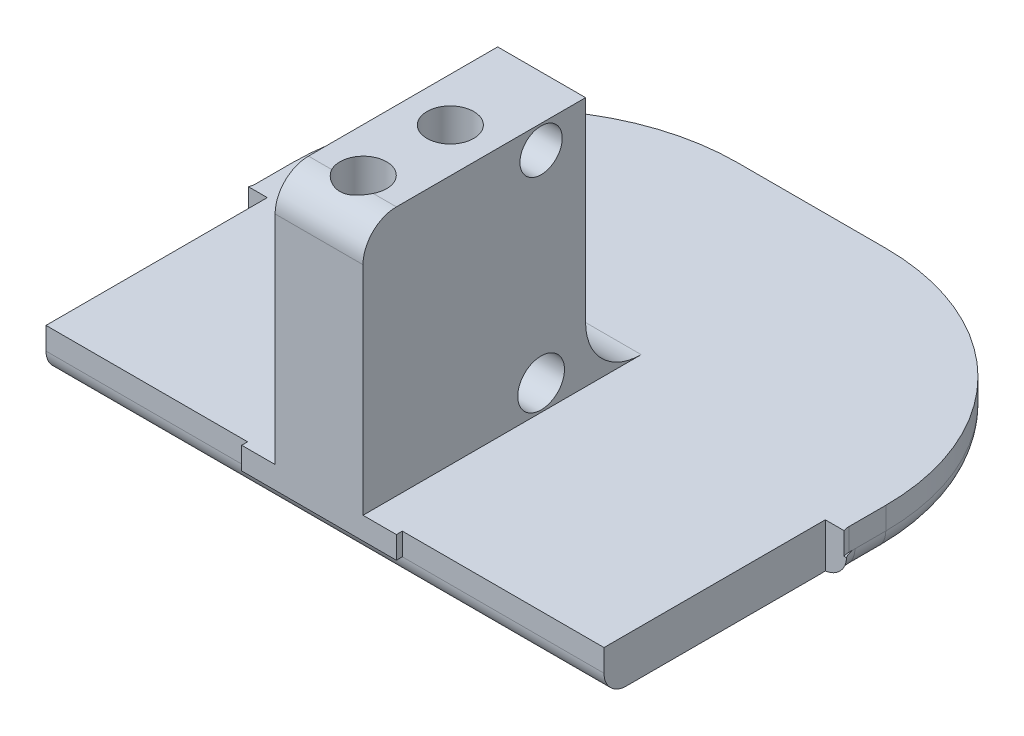
from build123d import *

# Parameters (mm, degrees)
SALIENTE_EXTRUIR1_DEPTH     = 2
CROQUIS2_W                  = 13.9
CROQUIS2_H                  = 20
SALIENTE_EXTRUIR2_DEPTH     = 24.5
SALIENTE_EXTRUIR3_DEPTH     = 22.5
CROQUIS5_R                  = 2.1
CORTAR_EXTRUIR2_DEPTH       = 20.5
CROQUIS16_W                 = 3
CROQUIS16_H                 = 33.930468167
CORTAR_EXTRUIR8_DEPTH       = 22.5
CORTAR_EXTRUIR1_DEPTH       = 27
CORTAR_EXTRUIR1_DEPTH_BACK  = 65.5
CROQUIS4_R                  = 1.599999999
REDONDEO1_R                 = 3
REDONDEO2_R                 = 5
SALIENTE_EXTRUIR5_START     = 2
SALIENTE_EXTRUIR5_DEPTH     = 2
REDONDEO6_R                 = 2
REDONDEO7_R                 = 2
CROQUIS17_R                 = 2.1
CORTAR_EXTRUIR9_DEPTH       = 10
CORTAR_EXTRUIR14_DEPTH      = 11
CORTAR_EXTRUIR14_DEPTH_BACK = 10
CROQUIS18_R                 = 1.9
CROQUIS19_R                 = 18.5
CORTAR_EXTRUIR15_DEPTH      = 3.5
CORTAR_EXTRUIR16_START      = -56
CROQUIS20_R                 = 18.5
CORTAR_EXTRUIR16_DEPTH      = 3.5
CORTAR_EXTRUIR17_DEPTH      = 47
CORTAR_EXTRUIR17_DEPTH_BACK = 86
CROQUIS21_W                 = 7.397871061
CROQUIS21_H                 = 19.885366365


# Some blends are built 0.0001 mm under size
with BuildPart() as part:
    # Croquis1 → Saliente-Extruir1 (new body)
    with BuildSketch(Plane(origin=(0, 0, 0), x_dir=(1, 0, 0), z_dir=(0, 1, 0))):
        with BuildLine():
            Line((-31.5, -9.464532567), (31.5, -9.464532567))
            Line((31.5, -9.464532567), (31.5, 7.964532567))
            ThreePointArc((31.5, 7.964532567), (31.060660172, 9.025192739), (30, 9.464532567))
            Line((30, 9.464532567), (28.160101256, 9.464532567))
            ThreePointArc((28.160101256, 9.464532567), (27.099441084, 9.903872396), (26.660101256, 10.964532567))
            Line((26.660101256, 10.964532567), (26.660101256, 14.266885585))
            ThreePointArc((26.660101256, 14.266885585), (20.802236879, 28.409021208), (6.660101256, 34.266885585))
            Line((6.660101256, 34.266885585), (-6.660101256, 34.266885585))
            ThreePointArc((-6.660101256, 34.266885585), (-20.802236879, 28.409021208), (-26.660101256, 14.266885585))
            Line((-26.660101256, 14.266885585), (-26.660101256, 10.964532567))
            ThreePointArc((-26.660101256, 10.964532567), (-27.099441084, 9.903872396), (-28.160101256, 9.464532567))
            Line((-28.160101256, 9.464532567), (-30, 9.464532567))
            ThreePointArc((-30, 9.464532567), (-31.060660172, 9.025192739), (-31.5, 7.964532567))
            Line((-31.5, 7.964532567), (-31.5, -9.464532567))
        make_face()
    extrude(amount=SALIENTE_EXTRUIR1_DEPTH)

    # Croquis2 → Saliente-Extruir2 (add)
    with BuildSketch(Plane(origin=(0, 0, 0), x_dir=(1, 0, 0), z_dir=(0, 1, 0))):
        Rectangle(CROQUIS2_W, CROQUIS2_H)
    extrude(amount=SALIENTE_EXTRUIR2_DEPTH)

    # Croquis3 → Saliente-Extruir3 (add)
    with BuildSketch(Plane(origin=(0, 2, 0), x_dir=(1, 0, 0), z_dir=(0, 1, 0))):
        with BuildLine():
            ThreePointArc((28.160101256, 9.464532567), (27.375457574, 9.686121721), (26.822638598, 10.285420177))
            Line((26.822638598, 10.285420177), (25.6, 10.285420177))
            Line((25.6, 10.285420177), (25.6, -2.749999823))
            Line((25.6, -2.749999823), (31.5, -2.749999823))
            Line((31.5, -2.749999823), (31.5, 7.964532567))
            ThreePointArc((31.5, 7.964532567), (31.060660172, 9.025192739), (30, 9.464532567))
            Line((30, 9.464532567), (28.160101256, 9.464532567))
        make_face()
        with BuildLine():
            Line((-25.6, 10.285420177), (-26.822638598, 10.285420177))
            ThreePointArc((-26.822638598, 10.285420177), (-27.375457574, 9.686121721), (-28.160101256, 9.464532567))
            Line((-28.160101256, 9.464532567), (-30, 9.464532567))
            ThreePointArc((-30, 9.464532567), (-31.060660172, 9.025192739), (-31.5, 7.964532567))
            Line((-31.5, 7.964532567), (-31.5, -2.749999823))
            Line((-31.5, -2.749999823), (-25.6, -2.749999823))
            Line((-25.6, -2.749999823), (-25.6, 10.285420177))
        make_face()
    extrude(amount=SALIENTE_EXTRUIR3_DEPTH)

    # Croquis5 → Cortar-Extruir2 (cut)
    with BuildSketch(Plane(origin=(0, 24.5, 0), x_dir=(1, 0, 0), z_dir=(0, 1, 0))):
        with Locations(Location((0, 1.798301608, 0), (0, 0, 270))):
            Circle(CROQUIS5_R)
        with Locations(Location((0, -6.026932469, 0), (0, 0, 270))):
            Circle(CROQUIS5_R)
        with Locations(Location((-28.55, 1.798301608, 0), (0, 0, 270))):
            Circle(CROQUIS5_R)
        with Locations(Location((28.55, 1.798301608, 0), (0, 0, 270))):
            Circle(CROQUIS5_R)
    extrude(amount=-CORTAR_EXTRUIR2_DEPTH, mode=Mode.SUBTRACT)

    # Croquis16 → Cortar-Extruir8 (cut)
    with BuildSketch(Plane(origin=(0, 24.5, 0), x_dir=(1, 0, 0), z_dir=(0, 1, 0))):
        with Locations((5.45, 0.270579682)):
            Rectangle(CROQUIS16_W, CROQUIS16_H)
        with Locations((-5.45, 0.270579682)):
            Rectangle(CROQUIS16_W, CROQUIS16_H)
    extrude(amount=-CORTAR_EXTRUIR8_DEPTH, mode=Mode.SUBTRACT)

    # Croquis4 → Cortar-Extruir1 (cut, two sides: drawn at the far end of the back side and taken through both)
    with BuildSketch(Plane.ZY.offset(25.5).offset(-CORTAR_EXTRUIR1_DEPTH_BACK)):
        with Locations(Location((-6.002353017, 4.3, 0), (0, 0, 180))):
            Circle(CROQUIS4_R)
        with Locations(Location((-6.002353017, 22.4, 0), (0, 0, 180))):
            Circle(CROQUIS4_R)
    extrude(amount=CORTAR_EXTRUIR1_DEPTH + CORTAR_EXTRUIR1_DEPTH_BACK, mode=Mode.SUBTRACT)

    # Redondeo1
    # the kernel refuses this fillet: 3 mm, written as the material it adds along each edge
    with BuildSketch(Plane(origin=(25.6, 2, 2.749999823), x_dir=(0, 0, 1), z_dir=(1, 0, 0))) as redondeo1_piece_1:
        with BuildLine():
            CenterArc((REDONDEO1_R, -REDONDEO1_R), REDONDEO1_R, 90, 90)
            Line((0, -REDONDEO1_R), (0, 0))
            Line((0, 0), (REDONDEO1_R, 0))
        make_face()
    extrude(amount=5.9)
    # the kernel refuses this fillet: 3 mm, written as the material it takes off along each edge
    with BuildSketch(Plane(origin=(11.45, 24.5, 10), x_dir=(0, 0, -1), z_dir=(-1, 0, 0))) as redondeo1_2_piece_1:
        with BuildLine():
            CenterArc((REDONDEO1_R, REDONDEO1_R), REDONDEO1_R, 180, 90)
            Line((0, REDONDEO1_R), (0, 0))
            Line((0, 0), (REDONDEO1_R, 0))
        make_face()
    extrude(amount=22.9, mode=Mode.SUBTRACT)

    # Redondeo2
    redondeo2_edges = [part.edges().sort_by_distance(p)[0] for p in [
        (0, 2, -10),
    ]]
    fillet(redondeo2_edges, radius=REDONDEO2_R)

    # Croquis15 → Saliente-Extruir5 (add)
    with BuildSketch(Plane.XZ.offset(SALIENTE_EXTRUIR5_START)):
        with BuildLine():
            Line((-31.5, 9.464532567), (31.5, 9.464532567))
            Line((31.5, 9.464532567), (31.5, -7.489095092))
            ThreePointArc((31.5, -7.489095092), (30.914213562, -8.903308654), (29.5, -9.489095092))
            Line((29.5, -9.489095092), (28.660101256, -9.489095092))
            ThreePointArc((28.660101256, -9.489095092), (27.245887693, -10.074881529), (26.660101256, -11.489095092))
            Line((26.660101256, -11.489095092), (26.660101256, -14.266885585))
            ThreePointArc((26.660101256, -14.266885585), (20.802236879, -28.409021208), (6.660101256, -34.266885585))
            Line((6.660101256, -34.266885585), (1.137553535, -34.266885585))
            Line((1.137553535, -34.266885585), (-1.137553535, -34.266885585))
            Line((-1.137553535, -34.266885585), (-6.660101256, -34.266885585))
            ThreePointArc((-6.660101256, -34.266885585), (-20.802236879, -28.409021208), (-26.660101256, -14.266885585))
            Line((-26.660101256, -14.266885585), (-26.660101256, -11.489095092))
            ThreePointArc((-26.660101256, -11.489095092), (-27.245887693, -10.074881529), (-28.660101256, -9.489095092))
            Line((-28.660101256, -9.489095092), (-29.5, -9.489095092))
            ThreePointArc((-29.5, -9.489095092), (-30.914213562, -8.903308654), (-31.5, -7.489095092))
            Line((-31.5, -7.489095092), (-31.5, 9.464532567))
        make_face()
    extrude(amount=-SALIENTE_EXTRUIR5_DEPTH)

    # Redondeo6
    redondeo6_edges = [part.edges().sort_by_distance(p)[0] for p in [
        (-31.5, -2, 0.987718738),
        (-30.914213562, -2, -8.903308654),
        (-29.080050628, -2, -9.489095092),
        (-27.245887693, -2, -10.074881529),
        (-26.660101256, -2, -12.877990338),
        (-20.802236879, -2, -28.409021208),
        (0, -2, -34.266885585),
        (20.802236879, -2, -28.409021208),
        (26.660101256, -2, -12.877990338),
        (27.245887693, -2, -10.074881529),
        (29.080050628, -2, -9.489095092),
        (30.914213562, -2, -8.903308654),
        (31.5, -2, 0.987718738),
    ]]
    fillet(redondeo6_edges, radius=REDONDEO6_R - 0.0001)  # a hair under: the kernel refuses the full size

    # Redondeo7
    redondeo7_edges = [part.edges().sort_by_distance(p)[0] for p in [
        (31.5, 0.99995, 9.464532567),
        (-31.5, 0.99995, 9.464532567),
        (0, -2, 9.464532567),
        (30.914242852, -1.414242852, 9.464532567),
        (-30.914242852, -1.414242852, 9.464532567),
    ]]
    fillet(redondeo7_edges, radius=REDONDEO7_R - 0.0001)  # a hair under: the kernel refuses the full size

    # Croquis17 → Cortar-Extruir9 (cut, symmetric)
    with BuildSketch(Plane(origin=(0, 0, 0), x_dir=(0, 0, -1), z_dir=(1, 0, 0))):
        with Locations((6.002353017, 4.3)):
            Circle(CROQUIS17_R)
    extrude(amount=CORTAR_EXTRUIR9_DEPTH, both=True, mode=Mode.SUBTRACT)

    # Croquis18 → Cortar-Extruir14 (cut, two sides: drawn at the far end of the back side and taken through both)
    with BuildSketch(Plane(origin=(0, 0, 0), x_dir=(0, 0, -1), z_dir=(1, 0, 0)).offset(-CORTAR_EXTRUIR14_DEPTH_BACK)):
        with Locations((6.002353017, 22.4)):
            Circle(CROQUIS18_R)
    extrude(amount=CORTAR_EXTRUIR14_DEPTH + CORTAR_EXTRUIR14_DEPTH_BACK, mode=Mode.SUBTRACT)

    # Croquis19 → Cortar-Extruir15 (cut)
    with BuildSketch(Plane(origin=(31.5, 0, 0), x_dir=(0, 0, -1), z_dir=(1, 0, 0))):
        with Locations((25.179802512, 14.045485316)):
            Circle(CROQUIS19_R)
    extrude(amount=-CORTAR_EXTRUIR15_DEPTH, mode=Mode.SUBTRACT)

    # Croquis20 → Cortar-Extruir16 (cut)
    with BuildSketch(Plane(origin=(28, 0, 0), x_dir=(0, 0, -1), z_dir=(1, 0, 0)).offset(CORTAR_EXTRUIR16_START)):
        with Locations((25.179802512, 14.045485316)):
            Circle(CROQUIS20_R)
    extrude(amount=-CORTAR_EXTRUIR16_DEPTH, mode=Mode.SUBTRACT)

    # Croquis21 → Cortar-Extruir17 (cut, two sides: drawn at the far end of the back side and taken through both)
    with BuildSketch(Plane(origin=(0, 2, 0), x_dir=(1, 0, 0), z_dir=(0, 1, 0)).offset(-CORTAR_EXTRUIR17_DEPTH_BACK)):
        with Locations((-28.769498571, 0.478150615)):
            Rectangle(CROQUIS21_W, CROQUIS21_H)
        with Locations((28.769498571, 0.478150615)):
            Rectangle(CROQUIS21_W, CROQUIS21_H)
    extrude(amount=CORTAR_EXTRUIR17_DEPTH + CORTAR_EXTRUIR17_DEPTH_BACK, mode=Mode.SUBTRACT)


solid = part.part
